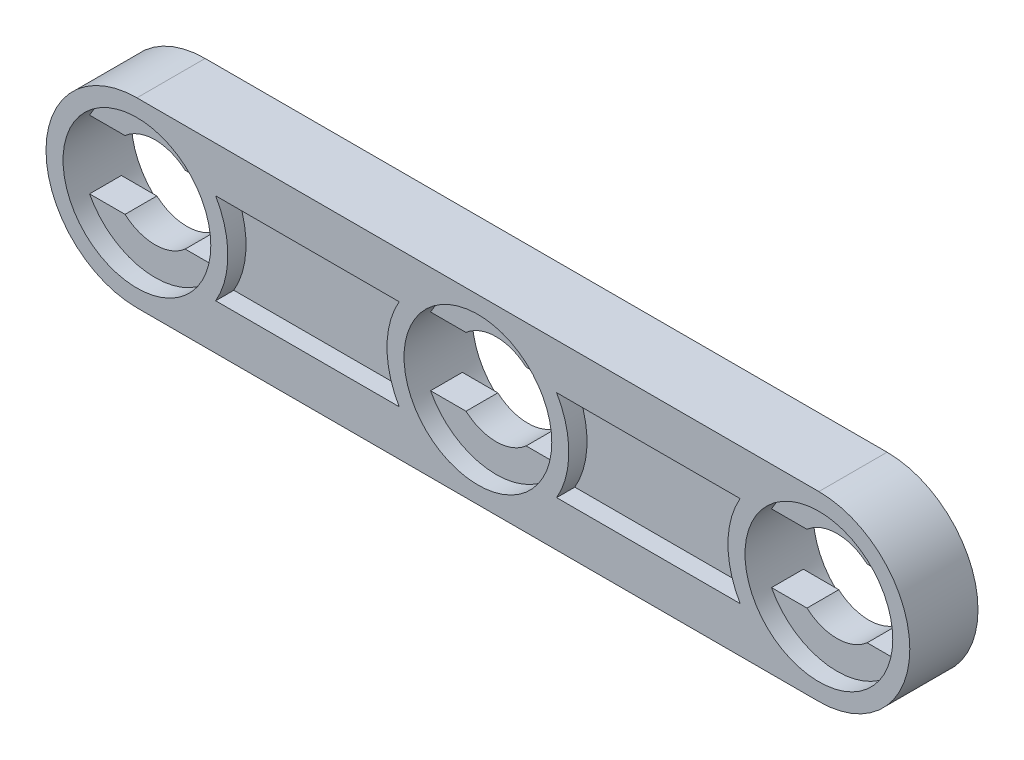
from build123d import *
from build123d.topology import SkipClean

# Parameters (mm, degrees)
EXTRUDE_1_DEPTH     = 3
CUT_EXTRUDE_1_REACH = 21.647
SKETCH_3_R          = 3.25
CUT_EXTRUDE_2_DEPTH = 0.8
CUT_EXTRUDE_START   = -2.2
SKETCH_3_2_R        = 3.25
CUT_EXTRUDE_3_DEPTH = 0.8
CUT_EXTRUDE_4_DEPTH = 0.8
CUT_EXTRUDE_5_DEPTH = 0.8


with BuildPart() as part:
    # 草图1 → 凸台-拉伸1 (new body)
    with BuildSketch(Plane.XY):
        with BuildLine():
            Line((-15, -4), (15, -4))
            ThreePointArc((15, -4), (19, 0), (15, 4))
            Line((15, 4), (-15, 4))
            ThreePointArc((-15, 4), (-19, 0), (-15, -4))
        make_face()
    extrude(amount=-EXTRUDE_1_DEPTH)

    # 草图2 → 切除-拉伸1 (cut, up to next)
    with BuildSketch(Plane.XY, mode=Mode.PRIVATE) as cut_extrude_1_sk1:
        with BuildLine():
            Line((-2.883140649, -1.5), (-1.322875656, -1.5))
            ThreePointArc((-1.322875656, -1.5), (0, -2), (1.322875656, -1.5))
            Line((1.322875656, -1.5), (2.883140649, -1.5))
            ThreePointArc((2.883140649, -1.5), (3.25, 0), (2.883140649, 1.5))
            Line((2.883140649, 1.5), (1.322875656, 1.5))
            ThreePointArc((1.322875656, 1.5), (0, 2), (-1.322875656, 1.5))
            Line((-1.322875656, 1.5), (-2.883140649, 1.5))
            ThreePointArc((-2.883140649, 1.5), (-3.25, 0), (-2.883140649, -1.5))
        make_face()
    cut_extrude_1_tool1 = extrude(cut_extrude_1_sk1.sketch, amount=-CUT_EXTRUDE_1_REACH, mode=Mode.PRIVATE) & part.part
    # 草图2 → 切除-拉伸1 (cut, up to next)
    with BuildSketch(Plane.XY, mode=Mode.PRIVATE) as cut_extrude_1_sk2:
        with BuildLine():
            Line((-17.883140649, 1.5), (-16.322875656, 1.5))
            ThreePointArc((-16.322875656, 1.5), (-15, 2), (-13.677124344, 1.5))
            Line((-13.677124344, 1.5), (-12.116859351, 1.5))
            ThreePointArc((-12.116859351, 1.5), (-11.75, 0), (-12.116859351, -1.5))
            Line((-12.116859351, -1.5), (-13.677124344, -1.5))
            ThreePointArc((-13.677124344, -1.5), (-15, -2), (-16.322875656, -1.5))
            Line((-16.322875656, -1.5), (-17.883140649, -1.5))
            ThreePointArc((-17.883140649, -1.5), (-18.25, 0), (-17.883140649, 1.5))
        make_face()
    cut_extrude_1_tool2 = extrude(cut_extrude_1_sk2.sketch, amount=-CUT_EXTRUDE_1_REACH, mode=Mode.PRIVATE) & part.part
    # 草图2 → 切除-拉伸1 (cut, up to next)
    with BuildSketch(Plane.XY, mode=Mode.PRIVATE) as cut_extrude_1_sk3:
        with BuildLine():
            Line((12.116859351, 1.5), (13.677124344, 1.5))
            ThreePointArc((13.677124344, 1.5), (15, 2), (16.322875656, 1.5))
            Line((16.322875656, 1.5), (17.883140649, 1.5))
            ThreePointArc((17.883140649, 1.5), (18.25, 0), (17.883140649, -1.5))
            Line((17.883140649, -1.5), (16.322875656, -1.5))
            ThreePointArc((16.322875656, -1.5), (15, -2), (13.677124344, -1.5))
            Line((13.677124344, -1.5), (12.116859351, -1.5))
            ThreePointArc((12.116859351, -1.5), (11.75, 0), (12.116859351, 1.5))
        make_face()
    cut_extrude_1_tool3 = extrude(cut_extrude_1_sk3.sketch, amount=-CUT_EXTRUDE_1_REACH, mode=Mode.PRIVATE) & part.part
    add(cut_extrude_1_tool1.solids().sort_by_distance((0, 0, 0))[0], mode=Mode.SUBTRACT)
    add(cut_extrude_1_tool2.solids().sort_by_distance((-15, 0, 0))[0], mode=Mode.SUBTRACT)
    add(cut_extrude_1_tool3.solids().sort_by_distance((15, 0, 0))[0], mode=Mode.SUBTRACT)

    # 草图3 → 切除-拉伸2 (cut)
    with SkipClean():  # the faces are left unmerged after this step: merging them gives an invalid solid
        with BuildSketch(Plane.XY):
            with Locations((-15, 0)):
                Circle(SKETCH_3_R)
            Circle(SKETCH_3_R)
            with Locations((15, 0)):
                Circle(SKETCH_3_R)
        extrude(amount=-CUT_EXTRUDE_2_DEPTH, mode=Mode.SUBTRACT)

    # 草图3<2> → 切除-拉伸3 (cut)
    with SkipClean():  # the faces are left unmerged after this step: merging them gives an invalid solid
        with BuildSketch(Plane.XY.offset(CUT_EXTRUDE_START)):
            with Locations((-15, 0)):
                Circle(SKETCH_3_2_R)
            Circle(SKETCH_3_2_R)
            with Locations((15, 0)):
                Circle(SKETCH_3_2_R)
        extrude(amount=-CUT_EXTRUDE_3_DEPTH, mode=Mode.SUBTRACT)

    # 草图4 → 切除-拉伸4 (cut)
    with SkipClean():  # the faces are left unmerged after this step: merging them gives an invalid solid
        with BuildSketch(Plane.XY):
            with BuildLine():
                Line((-11.535898385, 2), (-3.464101615, 2))
                ThreePointArc((-3.464101615, 2), (-4, 0), (-3.464101615, -2))
                Line((-3.464101615, -2), (-11.535898385, -2))
                ThreePointArc((-11.535898385, -2), (-11, 0), (-11.535898385, 2))
            make_face()
            with BuildLine():
                Line((3.464101615, 2), (11.535898385, 2))
                ThreePointArc((11.535898385, 2), (11, 0), (11.535898385, -2))
                Line((11.535898385, -2), (3.464101615, -2))
                ThreePointArc((3.464101615, -2), (4, 0), (3.464101615, 2))
            make_face()
        extrude(amount=-CUT_EXTRUDE_4_DEPTH, mode=Mode.SUBTRACT)

    # 草图4<2> → 切除-拉伸5 (cut)
    with SkipClean():  # the faces are left unmerged after this step: merging them gives an invalid solid
        with BuildSketch(Plane.XY.offset(CUT_EXTRUDE_START)):
            with BuildLine():
                Line((-11.535898385, 2), (-3.464101615, 2))
                ThreePointArc((-3.464101615, 2), (-4, 0), (-3.464101615, -2))
                Line((-3.464101615, -2), (-11.535898385, -2))
                ThreePointArc((-11.535898385, -2), (-11, 0), (-11.535898385, 2))
            make_face()
            with BuildLine():
                Line((3.464101615, 2), (11.535898385, 2))
                ThreePointArc((11.535898385, 2), (11, 0), (11.535898385, -2))
                Line((11.535898385, -2), (3.464101615, -2))
                ThreePointArc((3.464101615, -2), (4, 0), (3.464101615, 2))
            make_face()
        extrude(amount=-CUT_EXTRUDE_5_DEPTH, mode=Mode.SUBTRACT)


solid = part.part
